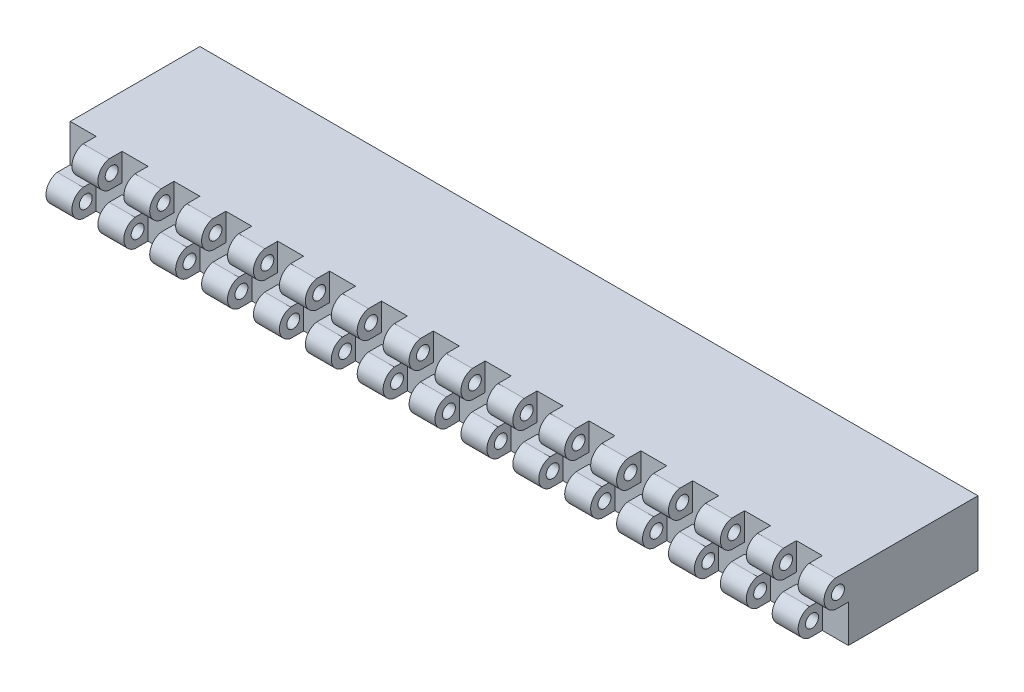
from build123d import *

# Parameters (mm, degrees)
SKETCH1_W           = 50
SKETCH1_H           = 25
BOSS_EXTRUDE1_DEPTH = 150
SKETCH2_R           = 2.5
BOSS_EXTRUDE2_DEPTH = 10
LPATTERN1_COUNT     = 15
LPATTERN1_PITCH     = 20
SKETCH4_R           = 8
CUT_EXTRUDE1_DEPTH  = 30
SKETCH3_R           = 2.5
BOSS_EXTRUDE3_DEPTH = 10
LPATTERN2_COUNT     = 15
LPATTERN2_PITCH     = 20


with BuildPart() as part:
    # Sketch1 → Boss-Extrude1 (new, symmetric)
    with BuildSketch(Plane(origin=(0, 0, 0), x_dir=(0, 0, -1), z_dir=(1, 0, 0))):
        Rectangle(SKETCH1_W, SKETCH1_H)
    extrude(amount=BOSS_EXTRUDE1_DEPTH, both=True)

    # Sketch2 → Boss-Extrude2 (add)
    with BuildSketch(Plane(origin=(150, 0, 0), x_dir=(0, 0, -1), z_dir=(1, 0, 0))):
        with BuildLine():
            Line((-25, 2), (-25, 12.5))
            Line((-25, 12.5), (-30, 12.5))
            ThreePointArc((-30, 12.5), (-34.344389582, 7.25), (-30, 2))
            Line((-30, 2), (-25, 2))
        make_face()
        with Locations((-29, 7.25)):
            Circle(SKETCH2_R, mode=Mode.SUBTRACT)
    boss_extrude2 = extrude(amount=-BOSS_EXTRUDE2_DEPTH)

    # LPattern1: Boss-Extrude2 ×15
    with Locations(*[(-i * LPATTERN1_PITCH, 0, 0) for i in range(1, LPATTERN1_COUNT)]):
        add(boss_extrude2)

    # Sketch4 → Cut-Extrude1 (cut)
    with BuildSketch(Plane(origin=(0, 0, -25), x_dir=(-1, 0, 0), z_dir=(0, 0, -1))):
        Circle(SKETCH4_R)
    extrude(amount=-CUT_EXTRUDE1_DEPTH, mode=Mode.SUBTRACT)

    # Sketch3 → Boss-Extrude3 (add)
    with BuildSketch(Plane.ZY.offset(150)):
        with BuildLine():
            Line((25, -2), (25, -12.5))
            Line((25, -12.5), (30, -12.5))
            ThreePointArc((30, -12.5), (34.344389582, -7.25), (30, -2))
            Line((30, -2), (25, -2))
        make_face()
        with Locations((29, -7.25)):
            Circle(SKETCH3_R, mode=Mode.SUBTRACT)
    boss_extrude3 = extrude(amount=-BOSS_EXTRUDE3_DEPTH)

    # LPattern2: Boss-Extrude3 ×15
    with Locations(*[(i * LPATTERN2_PITCH, 0, 0) for i in range(1, LPATTERN2_COUNT)]):
        add(boss_extrude3)


solid = part.part
